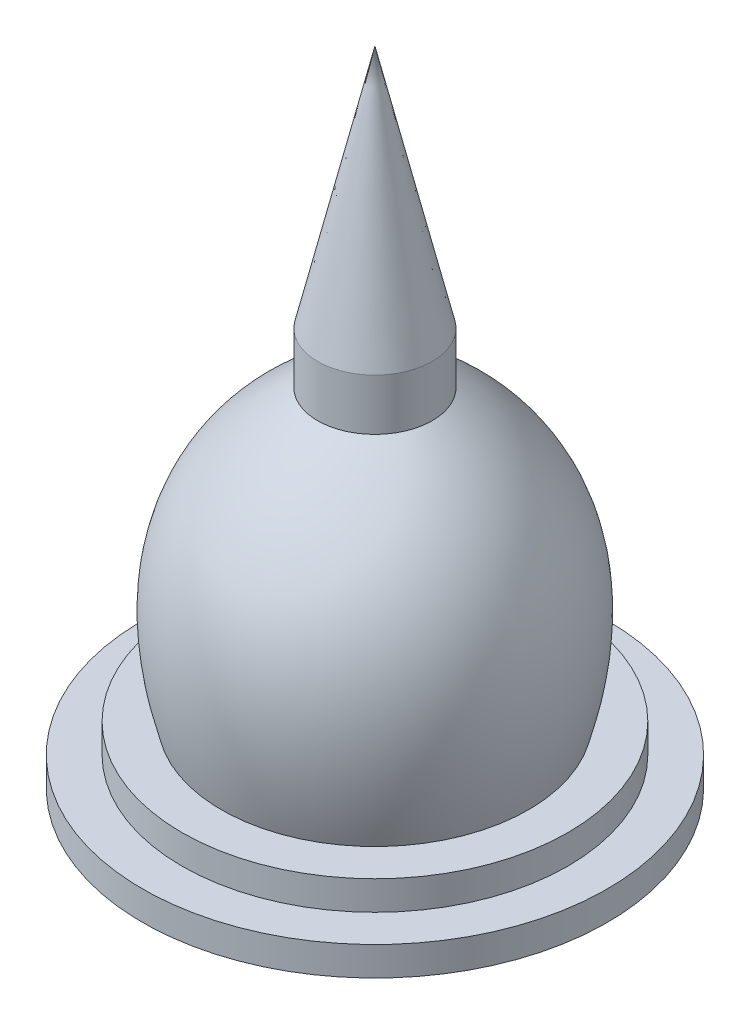
from build123d import *

# Parameters (mm, degrees)
SCALE1_SCALE = 3


with BuildPart() as part:
    # Sketch1 → Revolve1 (revolve)
    with BuildSketch(Plane.XY):
        with BuildLine():
            Line((-60, 0), (0, 0))
            Line((0, 0), (0, 165.974487707))
            Line((0, 165.974487707), (-14.807816841, 102.857120804))
            Line((-14.807816841, 102.857120804), (-14.807816841, 89.595445726))
            add(Edge.make_bspline(
                [(-39.636500765, 15.003432323), (-53.842680806, 64.800607808), (-14.807816841, 89.595445726)],
                knots=[0, 0, 0, 1, 1, 1], degree=2))
            Line((-39.636500765, 15.003432323), (-49.818250415, 15.003432323))
            Line((-49.818250415, 15.003432323), (-49.818250415, 7.502288215))
            Line((-49.818250415, 7.502288215), (-60, 7.501144108))
            Line((-60, 7.501144108), (-60, 0))
        make_face()
    revolve(axis=Axis((0, 0, 0), (0, 1, 0)))


with BuildPart() as part_1:
    # Scale1: scaled about (0, 38.251472445, 0)
    add(part.part.scale(SCALE1_SCALE).moved(Location((0, -76.50294489, 0))))


solid = part_1.part
